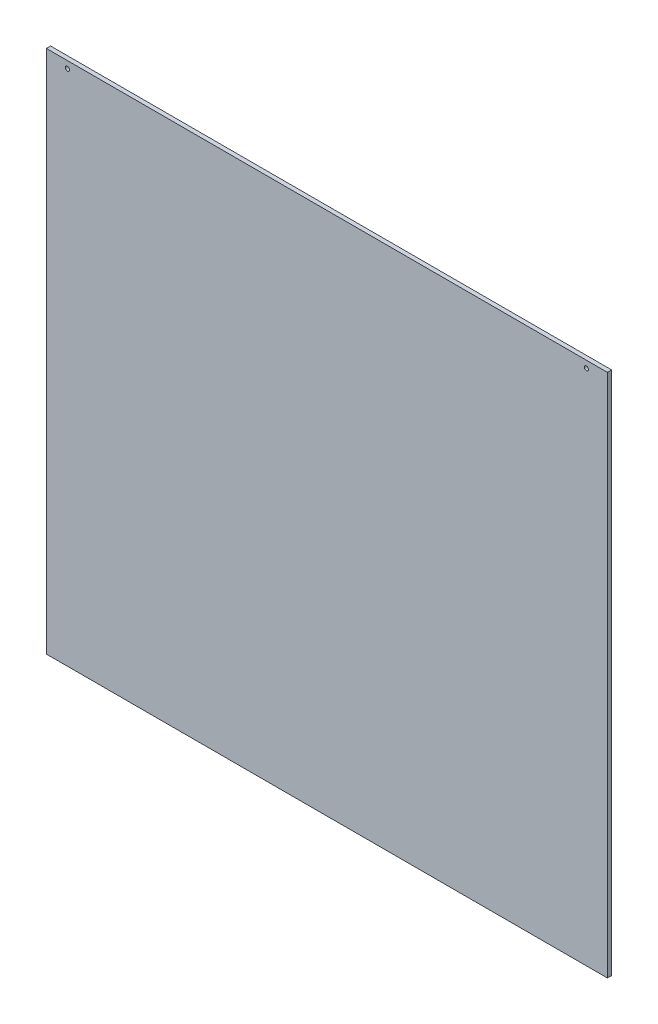
from build123d import *

# Parameters (mm, degrees)
SKETCH1_W           = 400
SKETCH1_H           = 374
BOSS_EXTRUDE1_DEPTH = 3
CUT_EXTRUDE1_REACH  = 275.821
SKETCH2_R           = 1.5


with BuildPart() as part:
    # Sketch1 → Boss-Extrude1 (new body)
    with BuildSketch(Plane.XY):
        Rectangle(SKETCH1_W, SKETCH1_H)
    extrude(amount=BOSS_EXTRUDE1_DEPTH)

    # Sketch2 → Cut-Extrude1 (cut, up to next)
    with BuildSketch(Plane(origin=(0, 0, 0), x_dir=(-1, 0, 0), z_dir=(0, 0, -1)), mode=Mode.PRIVATE) as cut_extrude1_sk1:
        with Locations((185, 182)):
            Circle(SKETCH2_R)
    cut_extrude1_tool1 = extrude(cut_extrude1_sk1.sketch, amount=-CUT_EXTRUDE1_REACH, mode=Mode.PRIVATE) & part.part
    # Sketch2 → Cut-Extrude1 (cut, up to next)
    with BuildSketch(Plane(origin=(0, 0, 0), x_dir=(-1, 0, 0), z_dir=(0, 0, -1)), mode=Mode.PRIVATE) as cut_extrude1_sk2:
        with Locations((-185, 182)):
            Circle(SKETCH2_R)
    cut_extrude1_tool2 = extrude(cut_extrude1_sk2.sketch, amount=-CUT_EXTRUDE1_REACH, mode=Mode.PRIVATE) & part.part
    add(cut_extrude1_tool1.solids().sort_by_distance((-185, 182, 0))[0], mode=Mode.SUBTRACT)
    add(cut_extrude1_tool2.solids().sort_by_distance((185, 182, 0))[0], mode=Mode.SUBTRACT)


solid = part.part
